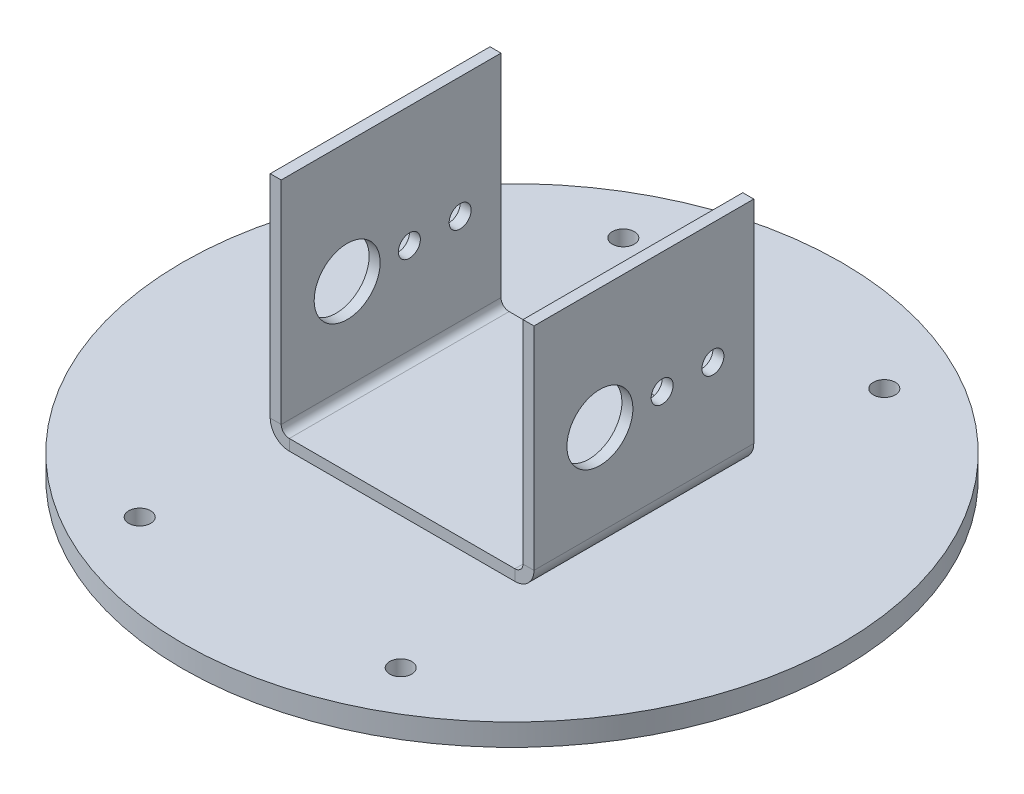
from build123d import *

# Parameters (mm, degrees)
SKETCH3_R                      = 30
SKETCH3_R_2                    = 1
BOSS_EXTRUDE1_DEPTH            = 2
SKETCH4_W                      = 22
SKETCH4_H                      = 20
BASE_FLANGE1_DEPTH             = 1
EDGE_FLANGE1_STRIP_W           = 5.4732
EDGE_FLANGE1_STRIP_H           = 1
EDGE_FLANGE1_STRIP_CUT_DEPTH   = 20
EDGE_FLANGE1_STRIP_2_W         = 5.4732
EDGE_FLANGE1_STRIP_2_H         = 1
EDGE_FLANGE1_STRIP_CUT_2_DEPTH = 20
EDGE_FLANGE1_DEPTH             = 20
EDGE_FLANGE1_BEND_DEPTH        = 20
CUT_EXTRUDE1_DEPTH             = 49.259714048
CUT_EXTRUDE1_DEPTH_BACK        = 49.259714048
SKETCH17_R                     = 3
SKETCH17_R_2                   = 1


# Sheet-metal steps are written as plain solids
with BuildPart() as part:
    # Sketch3 → Boss-Extrude1 (new body)
    with BuildSketch(Plane(origin=(0, 0, 0), x_dir=(1, 0, 0), z_dir=(0, 1, 0))):
        with Locations(Location((0, 0, 0), (0, 0, 270))):
            Circle(SKETCH3_R)
        with Locations(Location((-11.874342087, 22, 0), (0, 0, 270))):
            Circle(SKETCH3_R_2, mode=Mode.SUBTRACT)
        with Locations(Location((11.874342087, 22, 0), (0, 0, 270))):
            Circle(SKETCH3_R_2, mode=Mode.SUBTRACT)
        with Locations(Location((11.874342087, -22, 0), (0, 0, 270))):
            Circle(SKETCH3_R_2, mode=Mode.SUBTRACT)
        with Locations(Location((-11.874342087, -22, 0), (0, 0, 270))):
            Circle(SKETCH3_R_2, mode=Mode.SUBTRACT)
    extrude(amount=BOSS_EXTRUDE1_DEPTH)


with BuildPart() as body_2:
    # Sketch4 → Base-Flange1 (new body)
    with BuildSketch(Plane(origin=(0, 2, 0), x_dir=(1, 0, 0), z_dir=(0, 1, 0))):
        Rectangle(SKETCH4_W, SKETCH4_H)
    extrude(amount=BASE_FLANGE1_DEPTH)

    # Edge-Flange1 strip (across the edge) → Edge-Flange1 strip cut (cut)
    with BuildSketch(Plane(origin=(-11, 3, -10), x_dir=(1, 0, 0), z_dir=(0, 0, 1))):
        with Locations((-2, -0.5)):
            Rectangle(EDGE_FLANGE1_STRIP_W, EDGE_FLANGE1_STRIP_H)
    extrude(amount=EDGE_FLANGE1_STRIP_CUT_DEPTH, mode=Mode.SUBTRACT)

    # Edge-Flange1 strip 2 (across the edge) → Edge-Flange1 strip cut 2 (cut)
    with BuildSketch(Plane(origin=(11, 3, 10), x_dir=(-1, 0, 0), z_dir=(0, 0, -1))):
        with Locations((-2, -0.5)):
            Rectangle(EDGE_FLANGE1_STRIP_2_W, EDGE_FLANGE1_STRIP_2_H)
    extrude(amount=EDGE_FLANGE1_STRIP_CUT_2_DEPTH, mode=Mode.SUBTRACT)

    # Edge-Flange1 section (across the edge) → Edge-Flange1 (add)
    with BuildSketch(Plane(origin=(-11, 3, -10), x_dir=(1, 0, 0), z_dir=(0, 0, 1))):
        with BuildLine():
            Line((-1, 0.7366), (-1, 20))
            Line((-1, 20), (0, 20))
            Line((0, 20), (0, 0.7366))
            ThreePointArc((0, 0.7366), (0.215745145, 0.215745145), (0.7366, 0))
            Line((0.7366, 0), (0.7366, -1))
            ThreePointArc((0.7366, -1), (-0.491361636, -0.491361636), (-1, 0.7366))
        make_face()
    extrude(amount=EDGE_FLANGE1_DEPTH)

    # Edge-Flange1 section 2 (across the edge) → Edge-Flange1 bend (add)
    with BuildSketch(Plane(origin=(11, 3, 10), x_dir=(-1, 0, 0), z_dir=(0, 0, -1))):
        with BuildLine():
            Line((-1, 0.7366), (-1, 20))
            Line((-1, 20), (0, 20))
            Line((0, 20), (0, 0.7366))
            ThreePointArc((0, 0.7366), (0.215745145, 0.215745145), (0.7366, 0))
            Line((0.7366, 0), (0.7366, -1))
            ThreePointArc((0.7366, -1), (-0.491361636, -0.491361636), (-1, 0.7366))
        make_face()
    extrude(amount=EDGE_FLANGE1_BEND_DEPTH)

    # Sketch17 → Cut-Extrude1 (cut, two sides: drawn at the far end of the back side and taken through both)
    with BuildSketch(Plane(origin=(0, 0, 0), x_dir=(0, 0, -1), z_dir=(1, 0, 0)).offset(-CUT_EXTRUDE1_DEPTH_BACK)):
        with Locations(Location((-4, 12, 0), (0, 0, 270))):
            Circle(SKETCH17_R)
        with Locations(Location((1.662167446, 12, 0), (0, 0, 270))):
            Circle(SKETCH17_R_2)
        with Locations(Location((6.280617318, 12, 0), (0, 0, 270))):
            Circle(SKETCH17_R_2)
    extrude(amount=CUT_EXTRUDE1_DEPTH + CUT_EXTRUDE1_DEPTH_BACK, mode=Mode.SUBTRACT)


solid = Compound([part.part, body_2.part])
